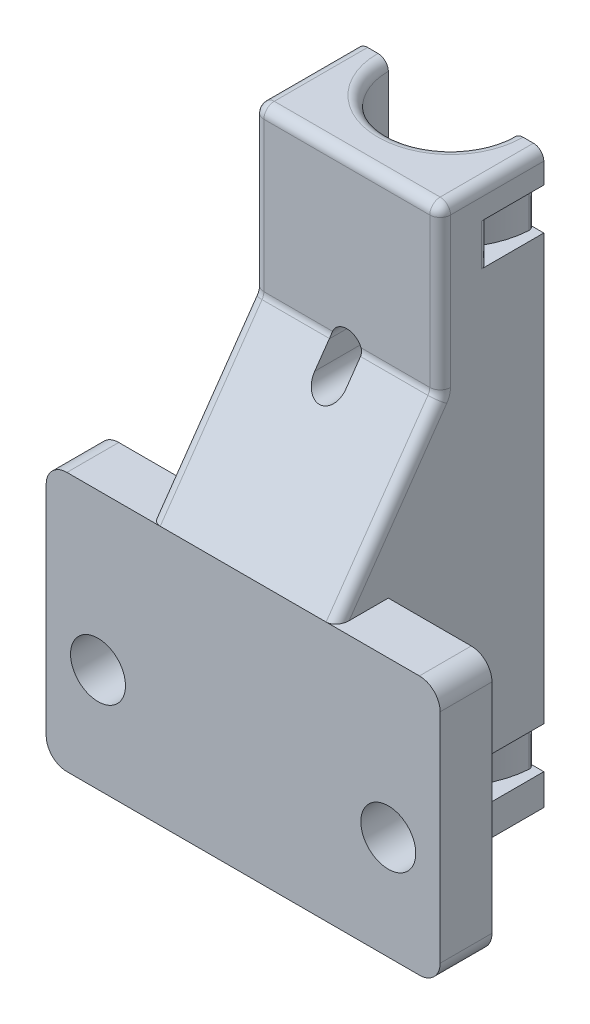
from build123d import *

# Parameters (mm, degrees)
BOSS_EXTRUDE1_DEPTH  = 20
M5_CLEARANCE_HOLE1_D = 5.3
SKETCH11_W           = 1.8
SKETCH11_H           = 4
FILLET2_START        = 3
FILLET2_DEPTH        = 4
MOVE_FACE1_BY        = 5
BOSS_EXTRUDE2_DEPTH  = 30
FILLET1_R            = 2
SKETCH13_W           = 10
SKETCH13_H           = 30
CUT_EXTRUDE1_DEPTH   = 65.876806449
CHAMFER3_SIZE        = 14.281480067
CHAMFER3_SIZE_2      = 10
FILLET3_R            = 1
CUT_EXTRUDE2_DEPTH   = 62.530480341


with BuildPart() as part:
    # Sketch4 → Boss-Extrude1 (new body)
    with BuildSketch(Plane(origin=(0, 0, 0), x_dir=(1, 0, 0), z_dir=(0, 1, 0))):
        with BuildLine():
            Line((19, 0), (-19, 0))
            Line((-19, 0), (-19, 5))
            Line((-19, 5), (-9, 5))
            Line((-9, 5), (-9, 20))
            Line((-9, 20), (-6, 20))
            ThreePointArc((-6, 20), (0, 14), (6, 20))
            Line((6, 20), (9, 20))
            Line((9, 20), (9, 5))
            Line((9, 5), (19, 5))
            Line((19, 5), (19, 0))
        make_face()
    extrude(amount=BOSS_EXTRUDE1_DEPTH)

    # M5 Clearance Hole1 (through all)
    with Locations(Plane(origin=(0, 0, -5), x_dir=(-1, 0, 0), z_dir=(0, 0, -1))):
        with Locations((-14, 10), (14, 10)):
            Hole(M5_CLEARANCE_HOLE1_D / 2)

    # Cut-Sweep1: sweep along a path in Sketch10
    with BuildLine(Plane(origin=(0, 5, 0), x_dir=(1, 0, 0), z_dir=(0, 1, 0))) as cut_sweep1_path:
        CenterArc((0, 20), 6, 0, 360)
    # Sketch11 → Cut-Sweep1 (sweep, cut)
    with BuildSketch(Plane(origin=(0, 0, -20), x_dir=(-1, 0, 0), z_dir=(0, 0, -1))):
        with Locations((-9, 5)):
            Rectangle(SKETCH11_W, SKETCH11_H)
    cut_sweep1 = sweep(path=cut_sweep1_path.line, mode=Mode.SUBTRACT)

    # Fillet2: read off the stored shape, not the designer's step
    # Fillet2 outline → Fillet2 (cut)
    with BuildSketch(Plane(origin=(0, 0, 0), x_dir=(1, 0, 0), z_dir=(0, 1, 0)).offset(FILLET2_START)):
        with BuildLine():
            ThreePointArc((7.583534796, 20), (7.948532993, 19.841725498), (8.082451559, 19.467105263))
            ThreePointArc((8.082451559, 19.467105263), (8.095611701, 19.733408201), (8.1, 20))
            Line((8.1, 20), (7.583534796, 20))
        make_face()
        with BuildLine():
            ThreePointArc((-8.1, 20), (-8.095611701, 19.733408201), (-8.082451559, 19.467105263))
            ThreePointArc((-8.082451559, 19.467105263), (-7.948532993, 19.841725498), (-7.583534796, 20))
            Line((-7.583534796, 20), (-8.1, 20))
        make_face()
        with BuildLine():
            Line((9, 14.007504693), (9, 15.875681875))
            ThreePointArc((9, 15.875681875), (8.582114467, 15.064687318), (8.091346154, 14.295605429))
            ThreePointArc((8.091346154, 14.295605429), (8.651117631, 14.484121375), (9, 14.007504693))
        make_face()
        with BuildLine():
            ThreePointArc((-8.091346154, 14.295605429), (-8.582114467, 15.064687318), (-9, 15.875681875))
            Line((-9, 15.875681875), (-9, 14.007504693))
            ThreePointArc((-9, 14.007504693), (-8.651117631, 14.484121375), (-8.091346154, 14.295605429))
        make_face()
    fillet2 = extrude(amount=FILLET2_DEPTH, mode=Mode.SUBTRACT)

    # Move Face1: a face moved outward by 5.0
    extrude(part.faces().sort_by_distance((0, 20, -7.09633707))[0], amount=MOVE_FACE1_BY, dir=(0, 1, 0))

    # Sketch12 → Boss-Extrude2 (add)
    with BuildSketch(Plane(origin=(0, 25, 0), x_dir=(1, 0, 0), z_dir=(0, 1, 0))):
        with BuildLine():
            Line((-9, 5), (-9, 0))
            Line((-9, 0), (9, 0))
            Line((9, 0), (9, 5))
            Line((9, 5), (9, 20))
            Line((9, 20), (6, 20))
            ThreePointArc((6, 20), (0, 14), (-6, 20))
            Line((-6, 20), (-9, 20))
            Line((-9, 20), (-9, 5))
        make_face()
    extrude(amount=BOSS_EXTRUDE2_DEPTH)

    # Fillet1
    fillet1_edges = [part.edges().sort_by_distance(p)[0] for p in [
        (19, 25, -2.5),
        (19, 0, -2.5),
        (-19, 0, -2.5),
        (-19, 25, -2.5),
    ]]
    fillet(fillet1_edges, radius=FILLET1_R)

    # Sketch13 → Cut-Extrude1 (cut, through all)
    with BuildSketch(Plane.ZY.offset(9)):
        with Locations((-5, 40)):
            Rectangle(SKETCH13_W, SKETCH13_H)
    extrude(amount=-CUT_EXTRUDE1_DEPTH, mode=Mode.SUBTRACT)

    # Chamfer3
    # the kernel refuses this chamfer: 14.281480067, 10 mm, written as the material it adds along each edge
    with BuildSketch(Plane(origin=(-9, 25, -10), x_dir=(0, 1, 0), z_dir=(1, 0, 0))) as chamfer3_piece_1_section:
        Polygon((CHAMFER3_SIZE, 0), (0, CHAMFER3_SIZE_2), (0, 0), align=None)
    chamfer3_piece_1 = extrude(amount=18, mode=Mode.PRIVATE)
    chamfer3_piece_1 = split(chamfer3_piece_1, bisect_by=Plane(origin=(-9, 25, 0), z_dir=(0, 0, -1)), keep=Keep.TOP, mode=Mode.PRIVATE)
    add(chamfer3_piece_1)

    # Fillet3
    fillet3_edges = [part.edges().sort_by_distance(p)[0] for p in [
        (0, 55, -14),
        (-9, 55, -15),
        (9, 55, -15),
        (0, 55, -10),
        (9, 47.140740034, -10),
        (-9, 47.140740034, -10),
        (0, 39.281480067, -10),
        (-9, 32.140740034, -5),
        (9, 32.140740034, -5),
    ]]
    fillet(fillet3_edges, radius=FILLET3_R)

    # Mirror1: Cut-Sweep1, Fillet2 across plane
    add(cut_sweep1.mirror(Plane.ZX.offset(27.5)), mode=Mode.SUBTRACT)
    add(fillet2.mirror(Plane.ZX.offset(27.5)), mode=Mode.SUBTRACT)

    # Sketch14 → Cut-Extrude2 (cut, through all)
    with BuildSketch(Plane(origin=(0, 0, -20), x_dir=(-1, 0, 0), z_dir=(0, 0, -1))):
        with BuildLine():
            Line((-1.5, 37), (-1.5, 39))
            ThreePointArc((-1.5, 39), (0, 40.5), (1.5, 39))
            Line((1.5, 39), (1.5, 37))
            ThreePointArc((1.5, 37), (0, 35.5), (-1.5, 37))
        make_face()
    extrude(amount=-CUT_EXTRUDE2_DEPTH, mode=Mode.SUBTRACT)


solid = part.part
